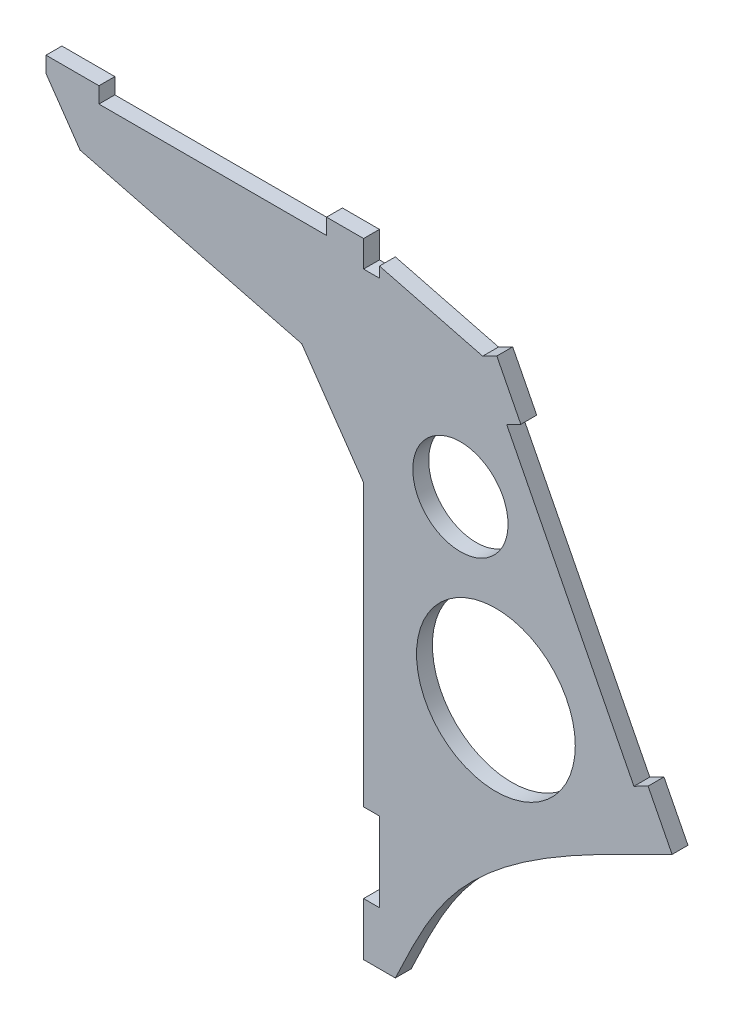
from build123d import *

# Parameters (mm, degrees)
SZKIC1_R                    = 15
SZKIC1_R_2                  = 9
DODANIE_WYCI_GNI_CIE1_DEPTH = 3


with BuildPart() as part:
    # Szkic1 → Dodanie-wyciągnięcie1 (new body)
    with BuildSketch(Plane.XY):
        with BuildLine():
            Line((-61.543338778, -53.44151614), (-19.664957518, -64.179657441))
            Line((-19.664957518, -64.179657441), (-7.985756698, -81.075775947))
            Line((-7.985756698, -81.075775947), (-7.985756698, -134.121370155))
            Line((-7.985756698, -134.121370155), (-4.985756698, -134.121370155))
            Line((-4.985756698, -134.121370155), (-4.985756698, -149.121370155))
            Line((-4.985756698, -149.121370155), (-7.985756698, -149.121370155))
            Line((-7.985756698, -149.121370155), (-7.985756698, -159.121370155))
            Line((-7.985756698, -159.121370155), (-1.985756698, -159.121369948))
            add(Edge.make_bspline(
                [(-1.985756698, -159.121369948), (0.831028128, -153.12663167), (10.702260865, -132.118475067), (32.240782886, -121.622376572), (47.633225323, -114.121370155)],
                knots=[0, 0, 0, 0, 0.285352894, 1, 1, 1, 1], degree=3))
            Line((47.633225323, -114.121370155), (50.306244895, -112.759398656))
            Line((50.306244895, -112.759398656), (45.766339898, -103.849333414))
            Line((45.766339898, -103.849333414), (43.093320325, -105.211304913))
            Line((43.093320325, -105.211304913), (19.053976103, -58.031435397))
            Line((19.053976103, -58.031435397), (21.726995675, -56.669463898))
            Line((21.726995675, -56.669463898), (17.187090678, -47.759398656))
            Line((17.187090678, -47.759398656), (14.514071105, -49.121370155))
            Line((14.514071105, -49.121370155), (-4.985756698, -44.121370155))
            Line((-4.985756698, -44.121370155), (-4.985756698, -46.121370155))
            Line((-4.985756698, -46.121370155), (-7.985756698, -46.121370155))
            Line((-7.985756698, -46.121370155), (-7.985756698, -41.121370155))
            Line((-7.985756698, -41.121370155), (-14.985756698, -41.121370155))
            Line((-14.985756698, -41.121370155), (-14.985756698, -44.121370155))
            Line((-14.985756698, -44.121370155), (-57.985756698, -44.121370155))
            Line((-57.985756698, -44.121370155), (-57.985756698, -41.121370155))
            Line((-57.985756698, -41.121370155), (-67.985756698, -41.121370155))
            Line((-67.985756698, -41.121370155), (-67.985756698, -44.121370155))
            Line((-67.985756698, -44.121370155), (-61.543338778, -53.44151614))
        make_face()
        with Locations((17.014243302, -104.121370155)):
            Circle(SZKIC1_R, mode=Mode.SUBTRACT)
        with Locations((10.310493617, -74.226697229)):
            Circle(SZKIC1_R_2, mode=Mode.SUBTRACT)
    extrude(amount=DODANIE_WYCI_GNI_CIE1_DEPTH)


solid = part.part
